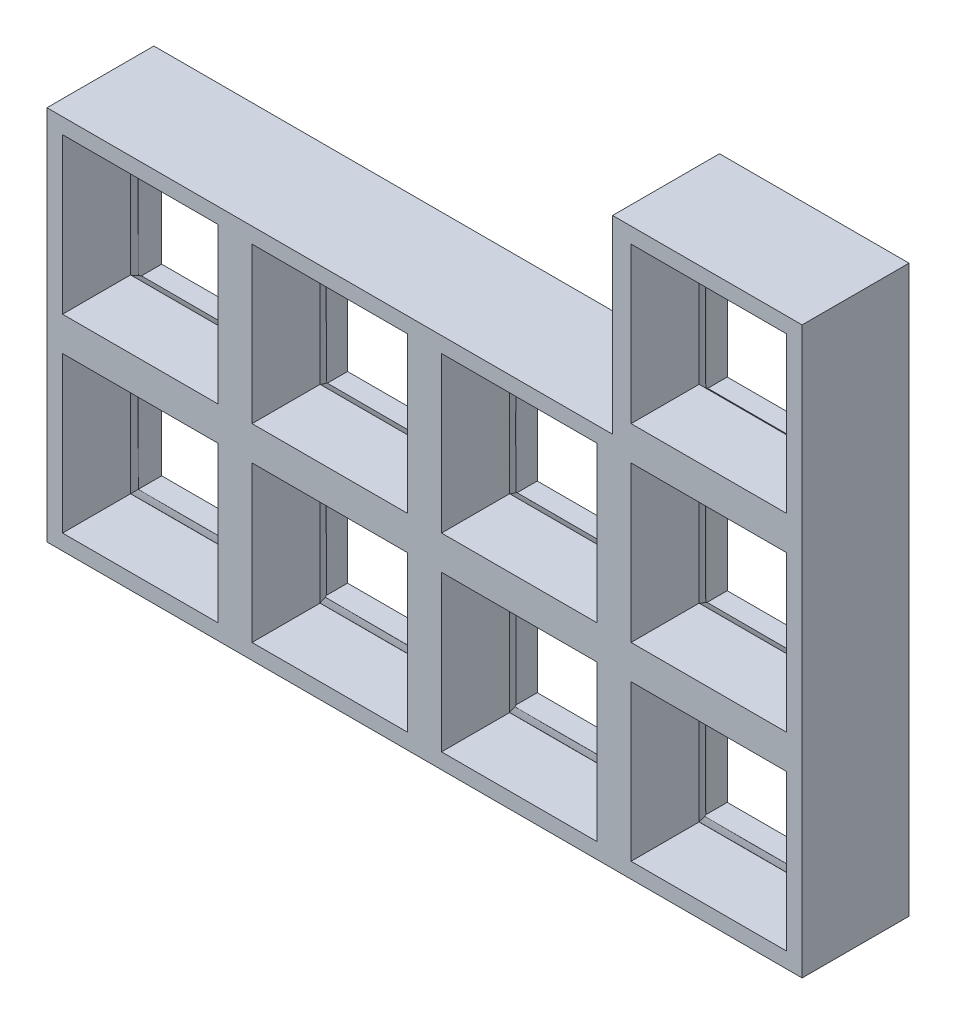
from build123d import *

# Parameters (mm, degrees)
SKICA1_W                = 16
SKICA1_H                = 16
P_IDAT_VYSUNUT_M1_DEPTH = 7
SKICA2_W                = 17.902222323
SKICA2_H                = 18.240617022
SKICA2_H_2              = 18.7
SKICA2_W_2              = 18.74773846
SKICA2_H_3              = 18.059382978
SKICA2_W_3              = 18.721275875
SKICA2_W_4              = 18.328763342
P_IDAT_VYSUNUT_M2_DEPTH = 4
ZAOBLIT1_START          = -8.8
ZAOBLIT1_DEPTH          = 37.1
ZAOBLIT1_START_2        = 29.1
ZAOBLIT1_2_DEPTH        = 18.7
ZAOBLIT1_3_DEPTH        = 76.8
ZAOBLIT1_START_3        = 49.397777677
ZAOBLIT1_4_DEPTH        = 18.602222323


with BuildPart() as part:
    # Skica1 → Přidat vysunutím1 (new body)
    with BuildSketch(Plane.XY):
        Polygon((-9.6, -9.6), (-9.6, 29.1), (48.597777677, 29.1), (48.597777677, 48.6), (68.1, 48.6), (68.1, -9.6), align=None)
        with Locations((19.5, 0)):
            Rectangle(SKICA1_W, SKICA1_H, mode=Mode.SUBTRACT)
        Rectangle(SKICA1_W, SKICA1_H, mode=Mode.SUBTRACT)
        with Locations((39, 0)):
            Rectangle(SKICA1_W, SKICA1_H, mode=Mode.SUBTRACT)
        with Locations((58.5, 0)):
            Rectangle(SKICA1_W, SKICA1_H, mode=Mode.SUBTRACT)
        with Locations((19.5, 19.5)):
            Rectangle(SKICA1_W, SKICA1_H, mode=Mode.SUBTRACT)
        with Locations((39, 19.5)):
            Rectangle(SKICA1_W, SKICA1_H, mode=Mode.SUBTRACT)
        with Locations((58.5, 19.5)):
            Rectangle(SKICA1_W, SKICA1_H, mode=Mode.SUBTRACT)
        with Locations((0, 19.5)):
            Rectangle(SKICA1_W, SKICA1_H, mode=Mode.SUBTRACT)
        with Locations((58.5, 39)):
            Rectangle(SKICA1_W, SKICA1_H, mode=Mode.SUBTRACT)
    extrude(amount=P_IDAT_VYSUNUT_M1_DEPTH)

    # Skica2 → Přidat vysunutím2 (add)
    with BuildSketch(Plane(origin=(0, 0, 0), x_dir=(-1, 0, 0), z_dir=(0, 0, -1))):
        Polygon((9.6, 29.1), (-48.597777677, 29.1), (-48.597777677, 48.6), (-68.1, 48.6), (-68.1, -9.6), (9.6, -9.6), align=None)
        with Locations((-58.348888839, 19.179691489)):
            Rectangle(SKICA2_W, SKICA2_H, mode=Mode.SUBTRACT)
        with Locations((-58.348888839, 38.45)):
            Rectangle(SKICA2_W, SKICA2_H_2, mode=Mode.SUBTRACT)
        with Locations((-39.223908447, 19.179691489)):
            Rectangle(SKICA2_W_2, SKICA2_H, mode=Mode.SUBTRACT)
        with Locations((-58.348888839, 0.229691489)):
            Rectangle(SKICA2_W, SKICA2_H_3, mode=Mode.SUBTRACT)
        with Locations((-39.223908447, 0.229691489)):
            Rectangle(SKICA2_W_2, SKICA2_H_3, mode=Mode.SUBTRACT)
        with Locations((-19.68940128, 0.229691489)):
            Rectangle(SKICA2_W_3, SKICA2_H_3, mode=Mode.SUBTRACT)
        with Locations((-0.364381671, 0.229691489)):
            Rectangle(SKICA2_W_4, SKICA2_H_3, mode=Mode.SUBTRACT)
        with Locations((-0.364381671, 19.179691489)):
            Rectangle(SKICA2_W_4, SKICA2_H, mode=Mode.SUBTRACT)
        with Locations((-19.68940128, 19.179691489)):
            Rectangle(SKICA2_W_3, SKICA2_H, mode=Mode.SUBTRACT)
    extrude(amount=P_IDAT_VYSUNUT_M2_DEPTH)

    # Zaoblit1: read off the stored shape, not the designer's step
    # Zaoblit1 outline → Zaoblit1 (add)
    with BuildSketch(Plane(origin=(0, 0, 0), x_dir=(1, 0, 0), z_dir=(0, 1, 0)).offset(ZAOBLIT1_START)):
        with BuildLine():
            Line((67.3, 0), (67.3, 1.6))
            add(Edge.make_bspline(
                [(67.3, 1.6), (67.3, 0.6), (66.5, 0)],
                knots=[0, 0, 0, 1, 1, 1], degree=2, weights=[1, 0.052631579, 1]))
            Line((66.5, 0), (67.3, 0))
        make_face()
        with BuildLine():
            Line((49.397777677, 0), (50.5, 0))
            add(Edge.make_bspline(
                [(49.397777677, 1.787175213), (49.397777677, 0.553695345), (50.5, 0)],
                knots=[0, 0, 0, 1, 1, 1], degree=2, weights=[1, 0.052631579, 1]))
            Line((49.397777677, 1.787175213), (49.397777677, 0))
        make_face()
        with BuildLine():
            add(Edge.make_bspline(
                [(9.528763342, 1.943691337), (9.528763342, 0.370639779), (8, 0)],
                knots=[0, 0, 0, 1, 1, 1], degree=2, weights=[1, 0.052631579, 1]))
            Line((8, 0), (9.528763342, 0))
            Line((9.528763342, 0), (9.528763342, 1.943691337))
        make_face()
        with BuildLine():
            add(Edge.make_bspline(
                [(-8.8, 1.6), (-8.8, 0.6), (-8, 0)],
                knots=[0, 0, 0, 1, 1, 1], degree=2, weights=[1, 0.052631579, 1]))
            Line((-8.8, 1.6), (-8.8, 0))
            Line((-8.8, 0), (-8, 0))
        make_face()
        with BuildLine():
            add(Edge.make_bspline(
                [(29.050039217, 1.948726583), (29.050039217, 0.357903908), (27.5, 0)],
                knots=[0, 0, 0, 1, 1, 1], degree=2, weights=[1, 0.052631579, 1]))
            Line((27.5, 0), (29.050039217, 0))
            Line((29.050039217, 0), (29.050039217, 1.948726583))
        make_face()
        with BuildLine():
            add(Edge.make_bspline(
                [(10.328763342, 1.820206396), (10.328763342, 0.533279088), (11.5, 0)],
                knots=[0, 0, 0, 1, 1, 1], degree=2, weights=[1, 0.052631579, 1]))
            Line((10.328763342, 1.820206396), (10.328763342, 0))
            Line((10.328763342, 0), (11.5, 0))
        make_face()
        with BuildLine():
            add(Edge.make_bspline(
                [(48.597777677, 1.959136851), (48.597777677, 0.328033158), (47, 0)],
                knots=[0, 0, 0, 1, 1, 1], degree=2, weights=[1, 0.052631579, 1]))
            Line((47, 0), (48.597777677, 0))
            Line((48.597777677, 0), (48.597777677, 1.959136851))
        make_face()
        with BuildLine():
            add(Edge.make_bspline(
                [(29.850039217, 1.810368285), (29.850039217, 0.539951882), (31, 0)],
                knots=[0, 0, 0, 1, 1, 1], degree=2, weights=[1, 0.052631579, 1]))
            Line((29.850039217, 1.810368285), (29.850039217, 0))
            Line((29.850039217, 0), (31, 0))
        make_face()
    extrude(amount=ZAOBLIT1_DEPTH)

    # Zaoblit1 2 outline → Zaoblit1 2 (add)
    with BuildSketch(Plane(origin=(0, 0, 0), x_dir=(1, 0, 0), z_dir=(0, 1, 0)).offset(ZAOBLIT1_START_2)):
        with BuildLine():
            Line((67.3, 0), (67.3, 1.6))
            add(Edge.make_bspline(
                [(67.3, 1.6), (67.3, 0.6), (66.5, 0)],
                knots=[0, 0, 0, 1, 1, 1], degree=2, weights=[1, 0.052631579, 1]))
            Line((66.5, 0), (67.3, 0))
        make_face()
        with BuildLine():
            Line((49.397777677, 0), (50.5, 0))
            add(Edge.make_bspline(
                [(49.397777677, 1.787175213), (49.397777677, 0.553695345), (50.5, 0)],
                knots=[0, 0, 0, 1, 1, 1], degree=2, weights=[1, 0.052631579, 1]))
            Line((49.397777677, 1.787175213), (49.397777677, 0))
        make_face()
    extrude(amount=ZAOBLIT1_2_DEPTH)

    # Zaoblit1 3 outline → Zaoblit1 3 (add)
    with BuildSketch(Plane.YZ.offset(ZAOBLIT1_START)):
        with BuildLine():
            add(Edge.make_bspline(
                [(28.3, -1.6), (28.3, -0.6), (27.5, 0)],
                knots=[0, 0, 0, 1, 1, 1], degree=2, weights=[1, 0.052631579, 1]))
            Line((28.3, -1.6), (28.3, 0))
            Line((28.3, 0), (27.5, 0))
        make_face()
        with BuildLine():
            Line((10.059382978, 0), (10.059382978, -1.920179857))
            add(Edge.make_bspline(
                [(10.059382978, -1.920179857), (10.059382978, -0.419677686), (11.5, 0)],
                knots=[0, 0, 0, 1, 1, 1], degree=2, weights=[1, 0.052631579, 1]))
            Line((11.5, 0), (10.059382978, 0))
        make_face()
        with BuildLine():
            add(Edge.make_bspline(
                [(9.259382978, -1.857817652), (9.259382978, -0.502051679), (8, 0)],
                knots=[0, 0, 0, 1, 1, 1], degree=2, weights=[1, 0.052631579, 1]))
            Line((9.259382978, -1.857817652), (9.259382978, 0))
            Line((9.259382978, 0), (8, 0))
        make_face()
        with BuildLine():
            Line((-8.8, 0), (-8.8, -1.6))
            add(Edge.make_bspline(
                [(-8.8, -1.6), (-8.8, -0.6), (-8, 0)],
                knots=[0, 0, 0, 1, 1, 1], degree=2, weights=[1, 0.052631579, 1]))
            Line((-8, 0), (-8.8, 0))
        make_face()
    extrude(amount=ZAOBLIT1_3_DEPTH)

    # Zaoblit1 4 outline → Zaoblit1 4 (add)
    with BuildSketch(Plane.YZ.offset(ZAOBLIT1_START_3)):
        with BuildLine():
            Line((29.1, 0), (29.1, -1.997498436))
            add(Edge.make_bspline(
                [(29.1, -1.997498436), (29.1, -0.095118973), (31, 0)],
                knots=[0, 0, 0, 1, 1, 1], degree=2, weights=[1, 0.052631579, 1]))
            Line((31, 0), (29.1, 0))
        make_face()
        with BuildLine():
            add(Edge.make_bspline(
                [(47.8, -1.6), (47.8, -0.6), (47, 0)],
                knots=[0, 0, 0, 1, 1, 1], degree=2, weights=[1, 0.052631579, 1]))
            Line((47.8, -1.6), (47.8, 0))
            Line((47.8, 0), (47, 0))
        make_face()
    extrude(amount=ZAOBLIT1_4_DEPTH)


solid = part.part
